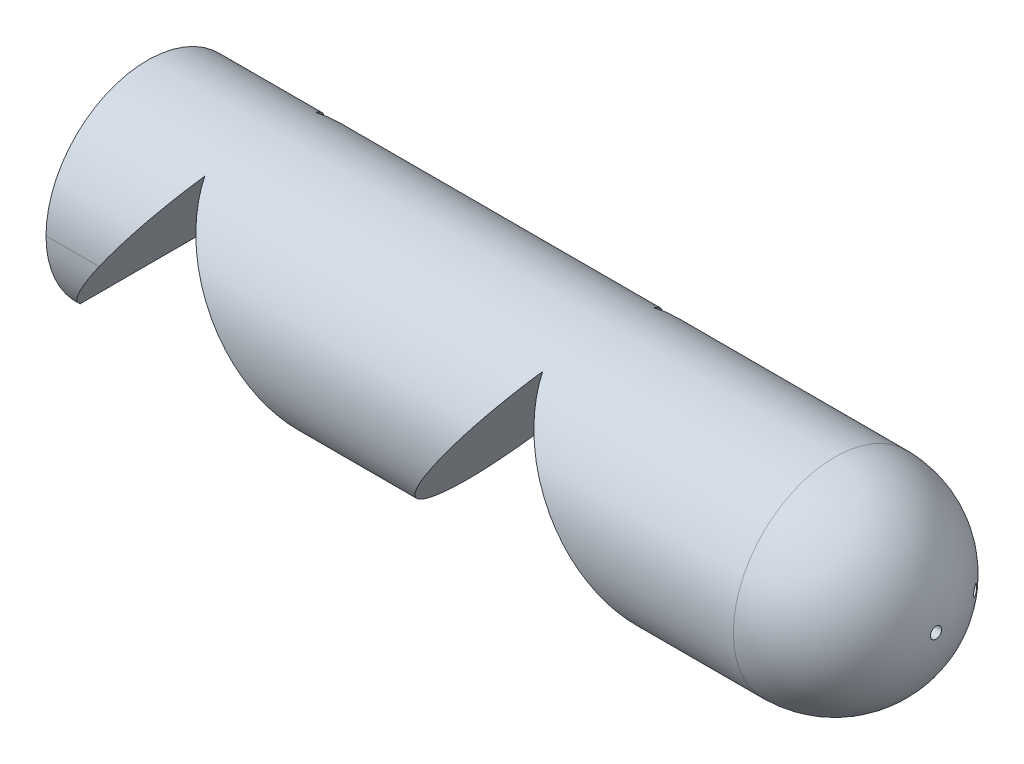
from build123d import *

# Parameters (mm, degrees)
SKETCH1_W                    = 70
SKETCH1_H                    = 9
FILLET1_R                    = 9
CUT_EXTRUDE1_DEPTH           = 15
SKETCH4_R                    = 0.2
CUT_EXTRUDE2_DEPTH           = 73.835430939
SKETCH5_R                    = 0.5
CUT_EXTRUDE3_DEPTH           = 5
CUT_EXTRUDE3_DRAFT           = -3
CUT_EXTRUDE3_PROFILE_2_DEPTH = 5
CUT_EXTRUDE3_PROFILE_2_DRAFT = -3


with BuildPart() as part:
    # Sketch1 → Revolve1 (revolve)
    with BuildSketch(Plane.XY):
        with Locations((35, 4.5)):
            Rectangle(SKETCH1_W, SKETCH1_H)
    revolve(axis=Axis((0, 9, 0), (1, 0, 0)))

    # Fillet1
    fillet1_edges = [part.edges().sort_by_distance(p)[0] for p in [
        (70, 18, 0),
    ]]
    fillet(fillet1_edges, radius=FILLET1_R)

    # Sketch2 → Cut-Extrude1 (cut, symmetric)
    with BuildSketch(Plane.XY):
        Polygon((-1.583487195, 0), (21.583487195, 0), (10, 16.542934148), align=None)
        Polygon((40, 16.542934148), (28.416512805, 0), (51.583487195, 0), align=None)
    extrude(amount=CUT_EXTRUDE1_DEPTH, both=True, mode=Mode.SUBTRACT)

    # Sketch4 → Cut-Extrude2 (cut, through all)
    with BuildSketch(Plane.ZY):
        with Locations((0, 9)):
            Circle(SKETCH4_R)
        with Locations((-5, 9)):
            Circle(SKETCH4_R)
    extrude(amount=-CUT_EXTRUDE2_DEPTH, mode=Mode.SUBTRACT)


with BuildPart() as cut_extrude3_tool:
    # Sketch5 → Cut-Extrude3 (with draft: the straight prism first)
    with BuildSketch(Plane(origin=(69.997777503, 0, 0), x_dir=(0, 0, -1), z_dir=(1, 0, 0))):
        with Locations((0, 9)):
            Circle(SKETCH5_R)
    extrude(amount=-CUT_EXTRUDE3_DEPTH)
    # Cut-Extrude3: the draft: its side faces are tilted about the plane it starts from
    cut_extrude3_sides = [cut_extrude3_tool.faces().sort_by_distance(p)[0] for p in [
        (67.497777503, 9, 0.5),
    ]]
    draft(cut_extrude3_sides, Plane(origin=(69.997777503, 0, 0), x_dir=(0, 0, -1), z_dir=(1, 0, 0)), CUT_EXTRUDE3_DRAFT)


with BuildPart() as part_1:
    add(part.part)

    # Cut-Extrude3: cut by cut_extrude3_tool
    add(cut_extrude3_tool.part, mode=Mode.SUBTRACT)


with BuildPart() as cut_extrude3_profile_2_tool:
    # Sketch5 → Cut-Extrude3 profile 2 (with draft: the straight prism first)
    with BuildSketch(Plane(origin=(69.997777503, 0, 0), x_dir=(0, 0, -1), z_dir=(1, 0, 0))):
        with Locations((5, 9)):
            Circle(SKETCH5_R)
    extrude(amount=-CUT_EXTRUDE3_PROFILE_2_DEPTH)
    # Cut-Extrude3 profile 2: the draft: its side faces are tilted about the plane it starts from
    cut_extrude3_profile_2_sides = [cut_extrude3_profile_2_tool.faces().sort_by_distance(p)[0] for p in [
        (67.497777503, 9, -4.5),
    ]]
    draft(cut_extrude3_profile_2_sides, Plane(origin=(69.997777503, 0, 0), x_dir=(0, 0, -1), z_dir=(1, 0, 0)), CUT_EXTRUDE3_PROFILE_2_DRAFT)


with BuildPart() as part_2:
    add(part_1.part)

    # Cut-Extrude3 profile 2: cut by cut_extrude3_profile_2_tool
    add(cut_extrude3_profile_2_tool.part, mode=Mode.SUBTRACT)


solid = part_2.part
